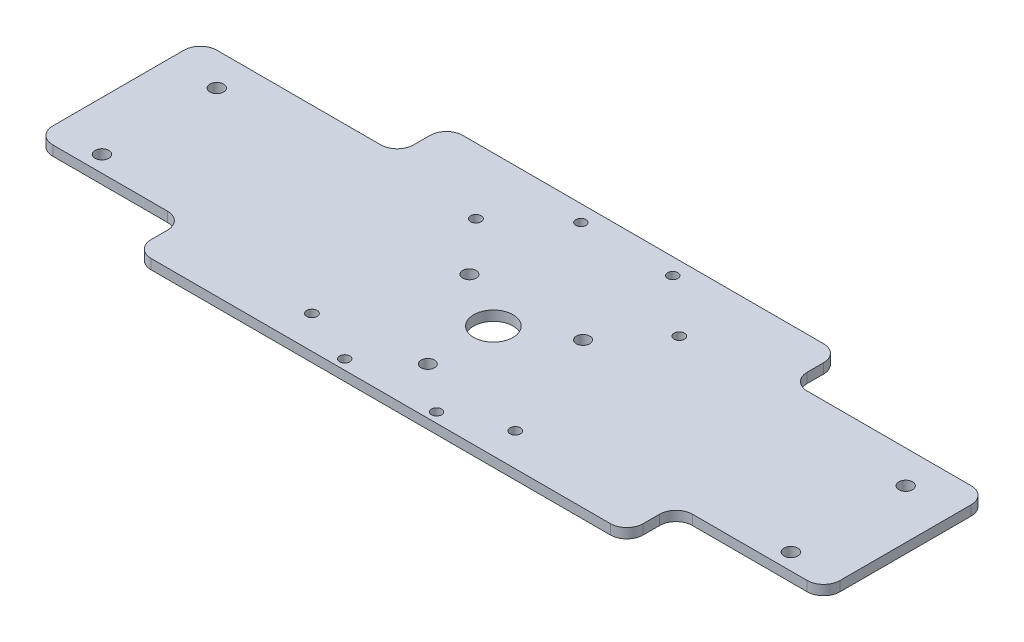
from build123d import *

# Parameters (mm, degrees)
SKETCH_1_R          = 2.1
EXTRUDE_1_DEPTH     = 3
SKETCH_3_R          = 1.6
SKETCH_3_R_2        = 1.55
SKETCH_3_W          = 45
SKETCH_3_H          = 15
CUT_EXTRUDE_2_DEPTH = 254
FILLET_1_R          = 5
SKETCH_4_R          = 6
SKETCH_4_R_2        = 2.05
CUT_EXTRUDE_3_DEPTH = 10


with BuildPart() as part:
    # 草图1 → 凸台-拉伸1 (new body)
    with BuildSketch(Plane(origin=(0, 0, 0), x_dir=(1, 0, 0), z_dir=(0, 1, 0))):
        Polygon((0, 65), (0, 0), (240, 0), (240, 65), (180, 65), (180, 80), (60, 80), (60, 65), align=None)
        with Locations((15, 20)):
            Circle(SKETCH_1_R, mode=Mode.SUBTRACT)
        with Locations((225, 20)):
            Circle(SKETCH_1_R, mode=Mode.SUBTRACT)
        with Locations((15, 55)):
            Circle(SKETCH_1_R, mode=Mode.SUBTRACT)
        with Locations((225, 55)):
            Circle(SKETCH_1_R, mode=Mode.SUBTRACT)
    extrude(amount=EXTRUDE_1_DEPTH)

    # 草图3 → 切除-拉伸2 (cut, through all)
    with BuildSketch(Plane.XZ):
        with Locations((89, -10)):
            Circle(SKETCH_3_R)
        with Locations((151, -10)):
            Circle(SKETCH_3_R)
        with Locations((151, -60)):
            Circle(SKETCH_3_R)
        with Locations((89, -60)):
            Circle(SKETCH_3_R)
        with Locations((106, -3)):
            Circle(SKETCH_3_R_2)
        with Locations((134, -3)):
            Circle(SKETCH_3_R_2)
        with Locations((134, -75)):
            Circle(SKETCH_3_R_2)
        with Locations((106, -75)):
            Circle(SKETCH_3_R_2)
        with Locations((22.5, -7.5)):
            Rectangle(SKETCH_3_W, SKETCH_3_H)
        with Locations((217.5, -7.5)):
            Rectangle(SKETCH_3_W, SKETCH_3_H)
    extrude(amount=-CUT_EXTRUDE_2_DEPTH, mode=Mode.SUBTRACT)

    # 圆角1
    fillet_1_edges = [part.edges().sort_by_distance(p)[0] for p in [
        (195, 1.5, 0),
        (195, 1.5, -15),
        (240, 1.5, -15),
        (240, 1.5, -65),
        (180, 1.5, -65),
        (180, 1.5, -80),
        (60, 1.5, -80),
        (0, 1.5, -65),
        (60, 1.5, -65),
        (45, 1.5, -15),
        (45, 1.5, 0),
        (0, 1.5, -15),
    ]]
    fillet(fillet_1_edges, radius=FILLET_1_R)

    # 草图4 → 切除-拉伸3 (cut)
    with BuildSketch(Plane.XZ):
        with Locations((120, -34.333475941)):
            Circle(SKETCH_4_R)
        with Locations((120, -14.333475941)):
            Circle(SKETCH_4_R_2)
        with Locations((137.320508076, -44.333475941)):
            Circle(SKETCH_4_R_2)
        with Locations((102.679491924, -44.333475941)):
            Circle(SKETCH_4_R_2)
    extrude(amount=-CUT_EXTRUDE_3_DEPTH, mode=Mode.SUBTRACT)


solid = part.part
